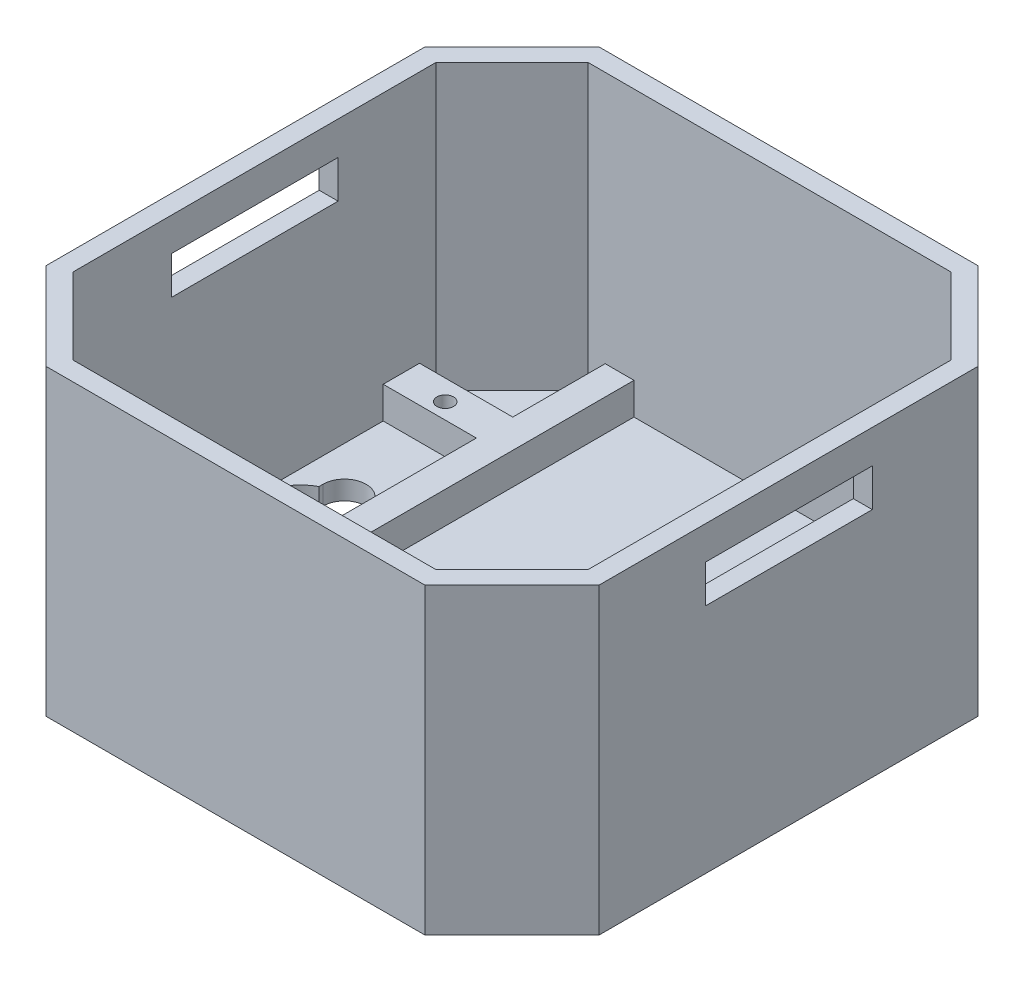
from build123d import *

# Parameters (mm, degrees)
SALIENTE_EXTRUIR1_DEPTH = 40
VACIADO1_T              = -2.5
CROQUIS5_W              = 22
CROQUIS5_H              = 5
CORTAR_EXTRUIR1_DEPTH   = 91.891418737
CORTAR_EXTRUIR2_DEPTH   = 10
SALIENTE_EXTRUIR4_DEPTH = 4.2
CROQUIS9_W              = 12.3
CROQUIS9_H              = 5
CORTAR_EXTRUIR3_DEPTH   = 64.802429421
CROQUIS10_R             = 6
CORTAR_EXTRUIR4_DEPTH   = 4
CROQUIS11_R             = 2.75
CORTAR_EXTRUIR5_DEPTH   = 4
CROQUIS12_R             = 1.1
CORTAR_EXTRUIR6_DEPTH   = 6


with BuildPart() as part:
    # Croquis3 → Saliente-Extruir1 (new body)
    with BuildSketch(Plane(origin=(0, 0, 0), x_dir=(1, 0, 0), z_dir=(0, 1, 0))):
        Polygon((-36.5, -25), (-25, -36.5), (25, -36.5), (36.5, -25), (36.5, 25), (25, 36.5), (-25, 36.5), (-36.5, 25), align=None)
    extrude(amount=SALIENTE_EXTRUIR1_DEPTH)

    # Vaciado1
    vaciado1_openings = [part.faces().sort_by_distance(p)[0] for p in [
        (0, 40, 0),
    ]]
    offset(amount=VACIADO1_T, openings=vaciado1_openings, kind=Kind.INTERSECTION)

    # Croquis5 → Cortar-Extruir1 (cut, through all)
    with BuildSketch(Plane.ZY.offset(36.5)):
        with Locations((-0.05, 33.1)):
            Rectangle(CROQUIS5_W, CROQUIS5_H)
    extrude(amount=-CORTAR_EXTRUIR1_DEPTH, mode=Mode.SUBTRACT)

    # Croquis6 → Cortar-Extruir2 (cut)
    with BuildSketch(Plane.XZ):
        with BuildLine():
            Line((-30.75, -5.8), (-30.75, -5.279914772))
            ThreePointArc((-30.75, -5.279914772), (-27.9, 6), (-25.05, -5.279914772))
            Line((-25.05, -5.279914772), (-25.05, -5.8))
            ThreePointArc((-25.05, -5.8), (-27.9, -8.65), (-30.75, -5.8))
        make_face()
        with BuildLine():
            Line((25.05, -5.8), (25.05, -5.279914772))
            ThreePointArc((25.05, -5.279914772), (27.9, 6), (30.75, -5.279914772))
            Line((30.75, -5.279914772), (30.75, -5.8))
            ThreePointArc((30.75, -5.8), (27.9, -8.65), (25.05, -5.8))
        make_face()
    extrude(amount=-CORTAR_EXTRUIR2_DEPTH, mode=Mode.SUBTRACT)

    # Croquis7 → Saliente-Extruir4 (add)
    with BuildSketch(Plane(origin=(0, 2.5, 0), x_dir=(1, 0, 0), z_dir=(0, 1, 0))):
        Polygon((-21.7, 0), (-21.7, 17), (-34, 17), (-34, 21.8), (-21.7, 21.8), (-21.7, 34), (-17.9, 34), (-17.9, -34), (-21.7, -34), (-23.964466094, -34), (-34, -23.964466094), (-34, -19.8), (-34, -15.8), (-21.7, -15.8), (-21.7, -10.8), (-34, -10.8), (-34, -6), (-21.7, -6), align=None)
        Polygon((21.7, -19.8), (21.7, -34), (17.9, -34), (17.9, 34), (21.7, 34), (21.7, 21.8), (34, 21.8), (34, 17), (21.7, 17), (21.7, 0), (21.7, -6), (34, -6), (34, -10.8), (21.7, -10.8), (21.7, -15.8), (34, -15.8), (34, -19.8), align=None)
    extrude(amount=SALIENTE_EXTRUIR4_DEPTH)

    # Croquis9 → Cortar-Extruir3 (cut, through all)
    with BuildSketch(Plane(origin=(0, 2.5, 0), x_dir=(1, 0, 0), z_dir=(0, 1, 0))):
        with Locations((-27.85, -13.3)):
            Rectangle(CROQUIS9_W, CROQUIS9_H)
        with Locations((27.85, -13.3)):
            Rectangle(CROQUIS9_W, CROQUIS9_H)
    extrude(amount=-CORTAR_EXTRUIR3_DEPTH, mode=Mode.SUBTRACT)

    # Croquis10 → Cortar-Extruir4 (cut)
    with BuildSketch(Plane(origin=(0, 6.7, 0), x_dir=(1, 0, 0), z_dir=(0, 1, 0))):
        with Locations((-24.9, -22.8)):
            Circle(CROQUIS10_R)
    extrude(amount=-CORTAR_EXTRUIR4_DEPTH, mode=Mode.SUBTRACT)

    # Croquis11 → Cortar-Extruir5 (cut)
    with BuildSketch(Plane(origin=(0, 2.7, 0), x_dir=(1, 0, 0), z_dir=(0, 1, 0))):
        with Locations((-24.9, -22.8)):
            Circle(CROQUIS11_R)
    extrude(amount=-CORTAR_EXTRUIR5_DEPTH, mode=Mode.SUBTRACT)

    # Croquis12 → Cortar-Extruir6 (cut)
    with BuildSketch(Plane(origin=(0, 6.7, 0), x_dir=(1, 0, 0), z_dir=(0, 1, 0))):
        with Locations((-27.91, 19.1)):
            Circle(CROQUIS12_R)
        with Locations((-27.91, -8.7)):
            Circle(CROQUIS12_R)
        with Locations((27.91, -8.7)):
            Circle(CROQUIS12_R)
        with Locations((27.91, 19.1)):
            Circle(CROQUIS12_R)
    extrude(amount=-CORTAR_EXTRUIR6_DEPTH, mode=Mode.SUBTRACT)


solid = part.part
